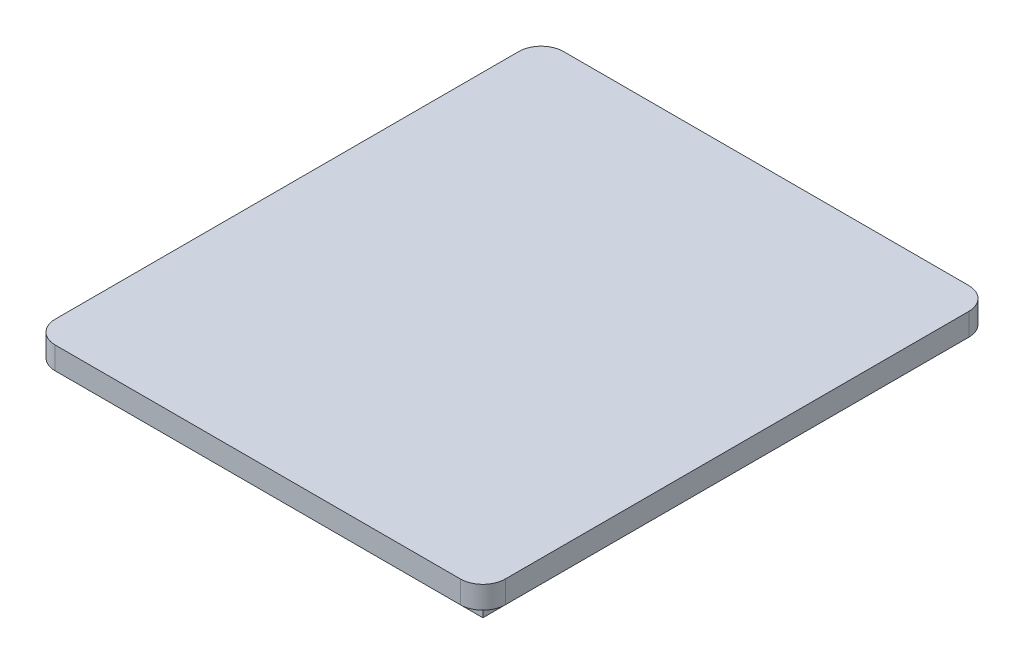
from build123d import *

# Parameters (mm, degrees)
SKETCH1_W           = 100.4
SKETCH1_H           = 113.4
BOSS_EXTRUDE1_DEPTH = 5
SKETCH2_W           = 90.4
SKETCH2_H           = 103.4
BOSS_EXTRUDE2_DEPTH = 5
FILLET1_R           = 5


with BuildPart() as part:
    # Sketch1 → Boss-Extrude1 (new body)
    with BuildSketch(Plane(origin=(0, 0, 0), x_dir=(1, 0, 0), z_dir=(0, 1, 0))):
        Rectangle(SKETCH1_W, SKETCH1_H)
    extrude(amount=BOSS_EXTRUDE1_DEPTH)

    # Sketch2 → Boss-Extrude2 (add)
    with BuildSketch(Plane.XZ):
        Rectangle(SKETCH2_W, SKETCH2_H)
    extrude(amount=BOSS_EXTRUDE2_DEPTH)

    # Fillet1
    fillet1_edges = [part.edges().sort_by_distance(p)[0] for p in [
        (-50.2, 2.5, -56.7),
        (50.2, 2.5, -56.7),
        (50.2, 2.5, 56.7),
        (-50.2, 2.5, 56.7),
    ]]
    fillet(fillet1_edges, radius=FILLET1_R)


solid = part.part
